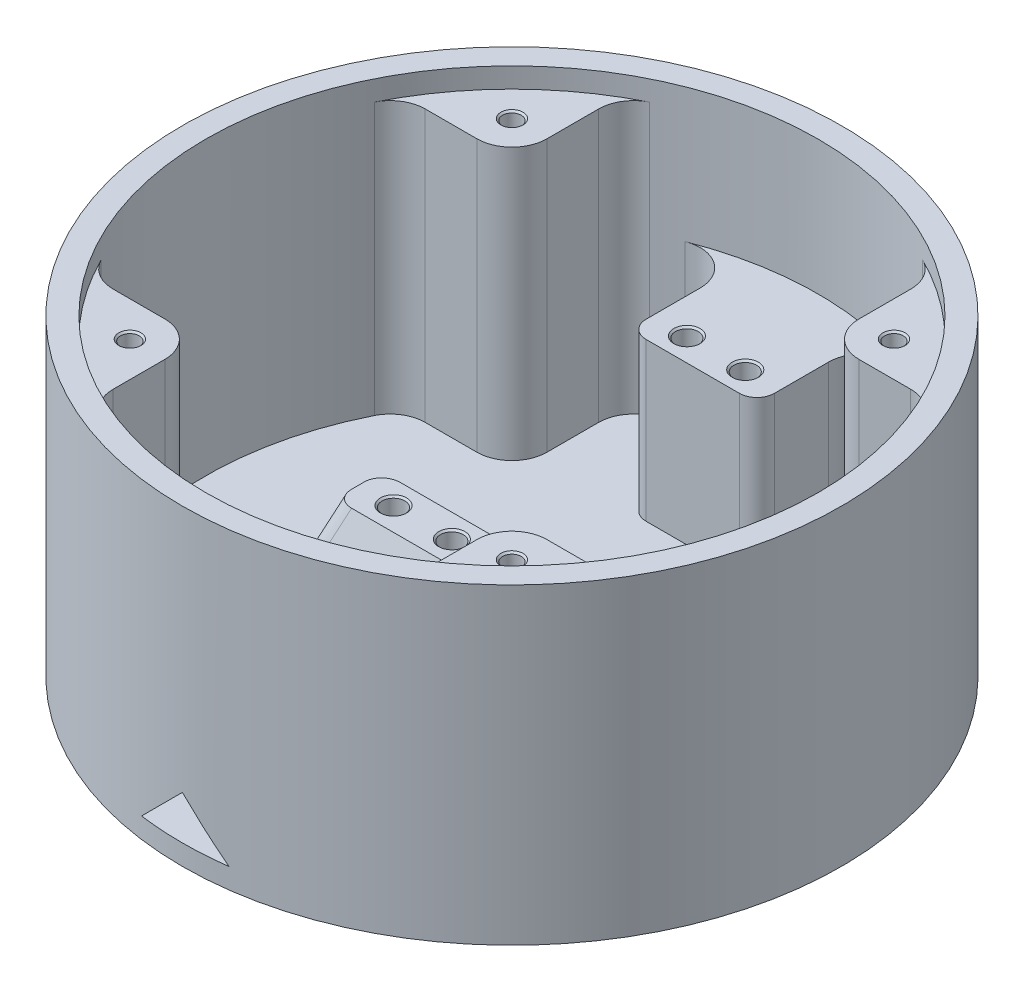
from build123d import *

# Parameters (mm, degrees)
SKETCH1_W               = 22
SKETCH1_H               = 8
SKETCH1_R               = 1.95
BOSS_EXTRUDE1_DEPTH     = 27
BOSS_EXTRUDE1_2_DEPTH   = 27
SKETCH1_4_R             = 1.95
BOSS_EXTRUDE2_DEPTH     = 12
SKETCH3_R               = 56.5
SKETCH3_R_2             = 52.5
BOSS_EXTRUDE3_DEPTH     = 3.5
BOSS_EXTRUDE4_START     = 50
SKETCH3_3_R             = 56.5
SKETCH3_3_R_2           = 52.5
BOSS_EXTRUDE4_DEPTH     = 50
BOSS_EXTRUDE5_START     = 46.54
SKETCH4_R               = 1.6
BOSS_EXTRUDE5_DEPTH     = 46.54
BOSS_EXTRUDE6_REACH     = 123.707
SKETCH5_W               = 22
SKETCH5_H               = 27
FILLET1_R               = 6
CHAMFER1_SIZE2          = 27
CHAMFER1_SIZE           = 10
CHAMFER2_SIZE2          = 27
CHAMFER2_SIZE           = 10
CHAMFER3_SIZE2          = 27
CHAMFER3_SIZE           = 10
CUT_EXTRUDE2_REACH      = 103.435
CUT_EXTRUDE2_END_RADIUS = 56.5
CHAMFER4_SIZE           = 5
CHAMFER5_SIZE           = 0.3
FILLET3_R               = 3


# Some blends are built 0.0001 mm under size
with BuildPart() as part:
    # Sketch1 → Boss-Extrude1 (new body)
    with BuildSketch(Plane(origin=(0, 0, 0), x_dir=(1, 0, 0), z_dir=(0, 1, 0))):
        with Locations((0, -25.15)):
            Rectangle(SKETCH1_W, SKETCH1_H)
        with Locations(Location((-5, -25.15, 0), (0, 0, 270))):
            Circle(SKETCH1_R, mode=Mode.SUBTRACT)
        with Locations(Location((5, -25.15, 0), (0, 0, 90))):
            Circle(SKETCH1_R, mode=Mode.SUBTRACT)
    extrude(amount=BOSS_EXTRUDE1_DEPTH)



with BuildPart() as body_2:
    # Sketch1 → Boss-Extrude1 2 (new body)
    with BuildSketch(Plane(origin=(0, 0, 0), x_dir=(1, 0, 0), z_dir=(0, 1, 0))):
        with Locations((0, 25.15)):
            Rectangle(SKETCH1_W, SKETCH1_H)
        with Locations(Location((5, 25.15, 0), (0, 0, 270))):
            Circle(SKETCH1_R, mode=Mode.SUBTRACT)
        with Locations(Location((-5, 25.15, 0), (0, 0, 90))):
            Circle(SKETCH1_R, mode=Mode.SUBTRACT)
    extrude(amount=BOSS_EXTRUDE1_2_DEPTH)


with BuildPart() as part_1:
    add(part.part)

    add(body_2.part)  # Boss-Extrude2 merges body 2
    # Sketch1<4> → Boss-Extrude2 (add)
    with BuildSketch(Plane(origin=(0, 0, 0), x_dir=(1, 0, 0), z_dir=(0, 1, 0))):
        with Locations(Location((-5, 25.15, 0), (0, 0, 90))):
            Circle(SKETCH1_4_R)
        with Locations(Location((5, 25.15, 0), (0, 0, 270))):
            Circle(SKETCH1_4_R)
        with Locations(Location((-5, -25.15, 0), (0, 0, 270))):
            Circle(SKETCH1_4_R)
        with Locations(Location((5, -25.15, 0), (0, 0, 90))):
            Circle(SKETCH1_4_R)
    extrude(amount=BOSS_EXTRUDE2_DEPTH)

    # Sketch3 → Boss-Extrude3 (add)
    # profile 1 of 2: a face of its own
    with BuildSketch(Plane(origin=(0, 0, 0), x_dir=(1, 0, 0), z_dir=(0, 1, 0))):
        with Locations(Location((0, -9.85, 0), (0, 0, 270))):
            Circle(SKETCH3_R)
        with Locations((0, -9.85)):
            Circle(SKETCH3_R_2, mode=Mode.SUBTRACT)
    # profile 2 of 2: a face of its own
    with BuildSketch(Plane(origin=(0, 0, 0), x_dir=(1, 0, 0), z_dir=(0, 1, 0))):
        with Locations((0, -9.85)):
            Circle(SKETCH3_R_2)
    extrude(amount=-BOSS_EXTRUDE3_DEPTH)

    # Sketch3<3> → Boss-Extrude4 (add)
    with BuildSketch(Plane(origin=(0, 0, 0), x_dir=(1, 0, 0), z_dir=(0, 1, 0)).offset(BOSS_EXTRUDE4_START)):
        with Locations(Location((0, -9.85, 0), (0, 0, 270))):
            Circle(SKETCH3_3_R)
        with Locations(Location((0, -9.85, 0), (0, 0, 270))):
            Circle(SKETCH3_3_R_2, mode=Mode.SUBTRACT)
    extrude(amount=-BOSS_EXTRUDE4_DEPTH)

    # Sketch4 → Boss-Extrude5 (add)
    # profile 1 of 4: a face of its own
    with BuildSketch(Plane(origin=(0, 0, 0), x_dir=(1, 0, 0), z_dir=(0, 1, 0)).offset(BOSS_EXTRUDE5_START)):
        with BuildLine():
            Line((26.75, 35.323969274), (26.75, 16.9))
            Line((26.75, 16.9), (45.173969274, 16.9))
            ThreePointArc((45.173969274, 16.9), (37.123106012, 27.273106012), (26.75, 35.323969274))
        make_face()
        with Locations(Location((32.75, 22.9, 0), (0, 0, 270))):
            Circle(SKETCH4_R, mode=Mode.SUBTRACT)
    # profile 2 of 4: a face of its own
    with BuildSketch(Plane(origin=(0, 0, 0), x_dir=(1, 0, 0), z_dir=(0, 1, 0)).offset(BOSS_EXTRUDE5_START)):
        with BuildLine():
            Line((26.75, -36.6), (26.75, -55.023969274))
            ThreePointArc((26.75, -55.023969274), (37.123106012, -46.973106012), (45.173969274, -36.6))
            Line((45.173969274, -36.6), (26.75, -36.6))
        make_face()
        with Locations(Location((32.75, -42.6, 0), (0, 0, 270))):
            Circle(SKETCH4_R, mode=Mode.SUBTRACT)
    # profile 3 of 4: a face of its own
    with BuildSketch(Plane(origin=(0, 0, 0), x_dir=(1, 0, 0), z_dir=(0, 1, 0)).offset(BOSS_EXTRUDE5_START)):
        with BuildLine():
            Line((-26.75, -36.6), (-45.173969274, -36.6))
            ThreePointArc((-45.173969274, -36.6), (-37.123106012, -46.973106012), (-26.75, -55.023969274))
            Line((-26.75, -55.023969274), (-26.75, -36.6))
        make_face()
        with Locations(Location((-32.75, -42.6, 0), (0, 0, 270))):
            Circle(SKETCH4_R, mode=Mode.SUBTRACT)
    # profile 4 of 4: a face of its own
    with BuildSketch(Plane(origin=(0, 0, 0), x_dir=(1, 0, 0), z_dir=(0, 1, 0)).offset(BOSS_EXTRUDE5_START)):
        with BuildLine():
            Line((-26.75, 16.9), (-26.75, 35.323969274))
            ThreePointArc((-26.75, 35.323969274), (-37.123106012, 27.273106012), (-45.173969274, 16.9))
            Line((-45.173969274, 16.9), (-26.75, 16.9))
        make_face()
        with Locations(Location((-32.75, 22.9, 0), (0, 0, 270))):
            Circle(SKETCH4_R, mode=Mode.SUBTRACT)
    extrude(amount=-BOSS_EXTRUDE5_DEPTH)

    # Sketch5 → Boss-Extrude6 (add, up to next)
    with BuildSketch(Plane(origin=(0, 0, -29.15), x_dir=(-1, 0, 0), z_dir=(0, 0, -1)), mode=Mode.PRIVATE) as boss_extrude6_sk1:
        with Locations((0, 13.5)):
            Rectangle(SKETCH5_W, SKETCH5_H)
    boss_extrude6_tool1 = extrude(boss_extrude6_sk1.sketch, amount=BOSS_EXTRUDE6_REACH, mode=Mode.PRIVATE) - part_1.part
    add(boss_extrude6_tool1.solids().sort_by_distance((0, 13.5, -29.15))[0])

    # Fillet1
    fillet1_edges = [part_1.edges().sort_by_distance(p)[0] for p in [
        (-45.173969274, 23.27, 36.6),
        (-26.75, 23.27, 55.023969274),
        (-26.75, 23.27, 36.6),
        (-26.75, 23.27, -35.323969274),
        (-45.173969274, 23.27, -16.9),
        (-26.75, 23.27, -16.9),
        (11, 13.5, -41.484686129),
        (-11, 13.5, -41.484686129),
        (45.173969274, 23.27, -16.9),
        (26.75, 23.27, -35.323969274),
        (26.75, 23.27, -16.9),
        (26.75, 23.27, 55.023969274),
        (45.173969274, 23.27, 36.6),
        (26.75, 23.27, 36.6),
    ]]
    fillet(fillet1_edges, radius=FILLET1_R)

    # Chamfer1
    chamfer1_edges = [part_1.edges().sort_by_distance(p)[0] for p in [
        (11, 0, 25.15),
    ]]
    chamfer1_side = [part_1.faces().sort_by_distance(p)[0] for p in [
        (11.2, 0, 25.15),
    ]]
    chamfer(chamfer1_edges, length=CHAMFER1_SIZE - 0.0001, length2=CHAMFER1_SIZE2 - 0.0001, reference=chamfer1_side[0])  # a hair under: the kernel refuses the full size

    # Chamfer2
    chamfer2_edges = [part_1.edges().sort_by_distance(p)[0] for p in [
        (-11, 0, 25.15),
    ]]
    chamfer2_side = [part_1.faces().sort_by_distance(p)[0] for p in [
        (-11.2, 0, 25.15),
    ]]
    chamfer(chamfer2_edges, length=CHAMFER2_SIZE - 0.0001, length2=CHAMFER2_SIZE2 - 0.0001, reference=chamfer2_side[0])  # a hair under: the kernel refuses the full size

    # Chamfer3
    chamfer3_edges = [part_1.edges().sort_by_distance(p)[0] for p in [
        (0, 0, 29.15),
    ]]
    chamfer3_side = [part_1.faces().sort_by_distance(p)[0] for p in [
        (0, 0, 29.35),
    ]]
    chamfer(chamfer3_edges, length=CHAMFER3_SIZE - 0.0001, length2=CHAMFER3_SIZE2 - 0.0001, reference=chamfer3_side[0])  # a hair under: the kernel refuses the full size

    # Cut-Extrude2: up to this cylinder (the profile starts inside it)
    cut_extrude2_end = Plane(origin=(0, 2.5, 9.85), z_dir=(0, 1, 0)) * Cylinder(CUT_EXTRUDE2_END_RADIUS, 320.87, mode=Mode.PRIVATE)
    # Sketch6 → Cut-Extrude2 (cut, up to the surface)
    with BuildSketch(Plane(origin=(0, 0, 21.15), x_dir=(-1, 0, 0), z_dir=(0, 0, -1)), mode=Mode.PRIVATE) as cut_extrude2_sk1:
        Polygon((-7.5, 0), (0, 7.5), (7.5, 0), align=None)
    cut_extrude2_tool1 = extrude(cut_extrude2_sk1.sketch, amount=-CUT_EXTRUDE2_REACH, mode=Mode.PRIVATE) & cut_extrude2_end
    add(cut_extrude2_tool1.solids().sort_by_distance((0, 2.5, 21.15))[0], mode=Mode.SUBTRACT)

    # Chamfer4
    chamfer4_edges = [part_1.edges().sort_by_distance(p)[0] for p in [
        (-3.75, 3.75, 21.15),
        (3.75, 3.75, 21.15),
    ]]
    chamfer(chamfer4_edges, length=CHAMFER4_SIZE)

    # Chamfer5
    chamfer5_edges = [part_1.edges().sort_by_distance(p)[0] for p in [
        (-32.75, 46.54, 41),
        (-32.75, 46.54, -24.5),
        (-5, 27, -23.2),
        (5, 27, -27.1),
        (5, 27, 27.1),
        (-5, 27, 23.2),
        (32.75, 46.54, -24.5),
        (32.75, 46.54, 41),
    ]]
    chamfer(chamfer5_edges, length=CHAMFER5_SIZE)

    # Fillet3
    # the kernel refuses this fillet: 3 mm, written as the material it takes off along each edge
    with BuildSketch(Plane(origin=(22.041837298, -2.813248419, 21.15), x_dir=(-0.9377494729497658, -0.34731243280717206, 0), z_dir=(-0.34731243280717206, 0.9377494729497658, 0))) as fillet3_piece_1_section:
        with BuildLine():
            CenterArc((FILLET3_R, FILLET3_R), FILLET3_R, 180, 90)
            Line((0, FILLET3_R), (-FILLET3_R * 0.02, FILLET3_R))
            Line((-FILLET3_R * 0.02, FILLET3_R), (-FILLET3_R * 0.02, -FILLET3_R * 0.02))
            Line((-FILLET3_R * 0.02, -FILLET3_R * 0.02), (FILLET3_R, -FILLET3_R * 0.02))
            Line((FILLET3_R, -FILLET3_R * 0.02), (FILLET3_R, 0))
        make_face()
    fillet3_piece_1 = extrude(amount=34.792231592, mode=Mode.PRIVATE)
    fillet3_piece_1 = split(fillet3_piece_1, bisect_by=Plane(origin=(15.663454903, 0, 21.857594663), z_dir=(0, 1, 0)), keep=Keep.TOP, mode=Mode.PRIVATE)
    add(fillet3_piece_1, mode=Mode.SUBTRACT)
    with BuildSketch(Plane(origin=(-22.041837298, -2.813248419, 21.15), x_dir=(0.9377494729497658, -0.3473124328071721, 0), z_dir=(0.3473124328071721, 0.9377494729497658, 0))) as fillet3_piece_2_section:
        with BuildLine():
            CenterArc((FILLET3_R, -FILLET3_R), FILLET3_R, 90, 90)
            Line((0, -FILLET3_R), (-FILLET3_R * 0.02, -FILLET3_R))
            Line((-FILLET3_R * 0.02, -FILLET3_R), (-FILLET3_R * 0.02, FILLET3_R * 0.02))
            Line((-FILLET3_R * 0.02, FILLET3_R * 0.02), (FILLET3_R, FILLET3_R * 0.02))
            Line((FILLET3_R, FILLET3_R * 0.02), (FILLET3_R, 0))
        make_face()
    fillet3_piece_2 = extrude(amount=34.792231592, mode=Mode.PRIVATE)
    fillet3_piece_2 = split(fillet3_piece_2, bisect_by=Plane(origin=(-15.663454903, 0, 21.857594663), z_dir=(0, 1, 0)), keep=Keep.TOP, mode=Mode.PRIVATE)
    add(fillet3_piece_2, mode=Mode.SUBTRACT)
    with BuildSketch(Plane(origin=(21.871802148, -2.354150623, 40.021802148), x_dir=(0.11394894991381442, -0.3076641019188203, -0.9446472554366656), z_dir=(-0.3280877364303264, 0.8858424659091759, -0.32808773643032624))) as fillet3_piece_3_section:
        with BuildLine():
            CenterArc((FILLET3_R * 0.885842465909, FILLET3_R), FILLET3_R, 186.928227911, 83.071772089)
            Line((-FILLET3_R * 0.106855567725, FILLET3_R * 0.879374074018), (-FILLET3_R * 0.126709528398, FILLET3_R * 0.876961555498))
            Line((-FILLET3_R * 0.126709528398, FILLET3_R * 0.876961555498), (-FILLET3_R * 0.0177168493182, -FILLET3_R * 0.02))
            Line((-FILLET3_R * 0.0177168493182, -FILLET3_R * 0.02), (FILLET3_R * 0.885842465909, -FILLET3_R * 0.02))
            Line((FILLET3_R * 0.885842465909, -FILLET3_R * 0.02), (FILLET3_R * 0.885842465909, 0))
        make_face()
    fillet3_piece_3 = extrude(amount=35.794401902, mode=Mode.PRIVATE)
    fillet3_piece_3 = split(fillet3_piece_3, bisect_by=Plane(origin=(15.900019332, 0, 34.050019332), z_dir=(0, 1, 0)), keep=Keep.TOP, mode=Mode.PRIVATE)
    add(fillet3_piece_3, mode=Mode.SUBTRACT)
    with BuildSketch(Plane(origin=(-21.871802148, -2.354150623, 40.021802148), x_dir=(-0.11394894991381556, -0.3076641019188198, -0.9446472554366654), z_dir=(0.32808773643032646, 0.8858424659091759, -0.32808773643032624))) as fillet3_piece_4_section:
        with BuildLine():
            CenterArc((FILLET3_R * 0.885842465909, -FILLET3_R), FILLET3_R, 90, 83.071772089)
            Line((-FILLET3_R * 0.106855567725, -FILLET3_R * 0.879374074018), (-FILLET3_R * 0.126709528398, -FILLET3_R * 0.876961555498))
            Line((-FILLET3_R * 0.126709528398, -FILLET3_R * 0.876961555498), (-FILLET3_R * 0.0177168493182, FILLET3_R * 0.02))
            Line((-FILLET3_R * 0.0177168493182, FILLET3_R * 0.02), (FILLET3_R * 0.885842465909, FILLET3_R * 0.02))
            Line((FILLET3_R * 0.885842465909, FILLET3_R * 0.02), (FILLET3_R * 0.885842465909, 0))
        make_face()
    fillet3_piece_4 = extrude(amount=35.794401902, mode=Mode.PRIVATE)
    fillet3_piece_4 = split(fillet3_piece_4, bisect_by=Plane(origin=(-15.900019332, 0, 34.050019332), z_dir=(0, 1, 0)), keep=Keep.TOP, mode=Mode.PRIVATE)
    add(fillet3_piece_4, mode=Mode.SUBTRACT)
    with BuildSketch(Plane(origin=(11, 0, -21.15), x_dir=(0, 0, -1), z_dir=(0, 1, 0)), Plane(origin=(-11, 0, -21.15), x_dir=(1, 0, 0), z_dir=(0, 1, 0))) as fillet3_piece_5:
        with BuildLine():
            CenterArc((FILLET3_R, FILLET3_R), FILLET3_R, 180, 90)
            Line((0, FILLET3_R), (-FILLET3_R * 0.02, FILLET3_R))
            Line((-FILLET3_R * 0.02, FILLET3_R), (-FILLET3_R * 0.02, -FILLET3_R * 0.02))
            Line((-FILLET3_R * 0.02, -FILLET3_R * 0.02), (FILLET3_R, -FILLET3_R * 0.02))
            Line((FILLET3_R, -FILLET3_R * 0.02), (FILLET3_R, 0))
        make_face()
    extrude(amount=30, mode=Mode.SUBTRACT)


solid = part_1.part
